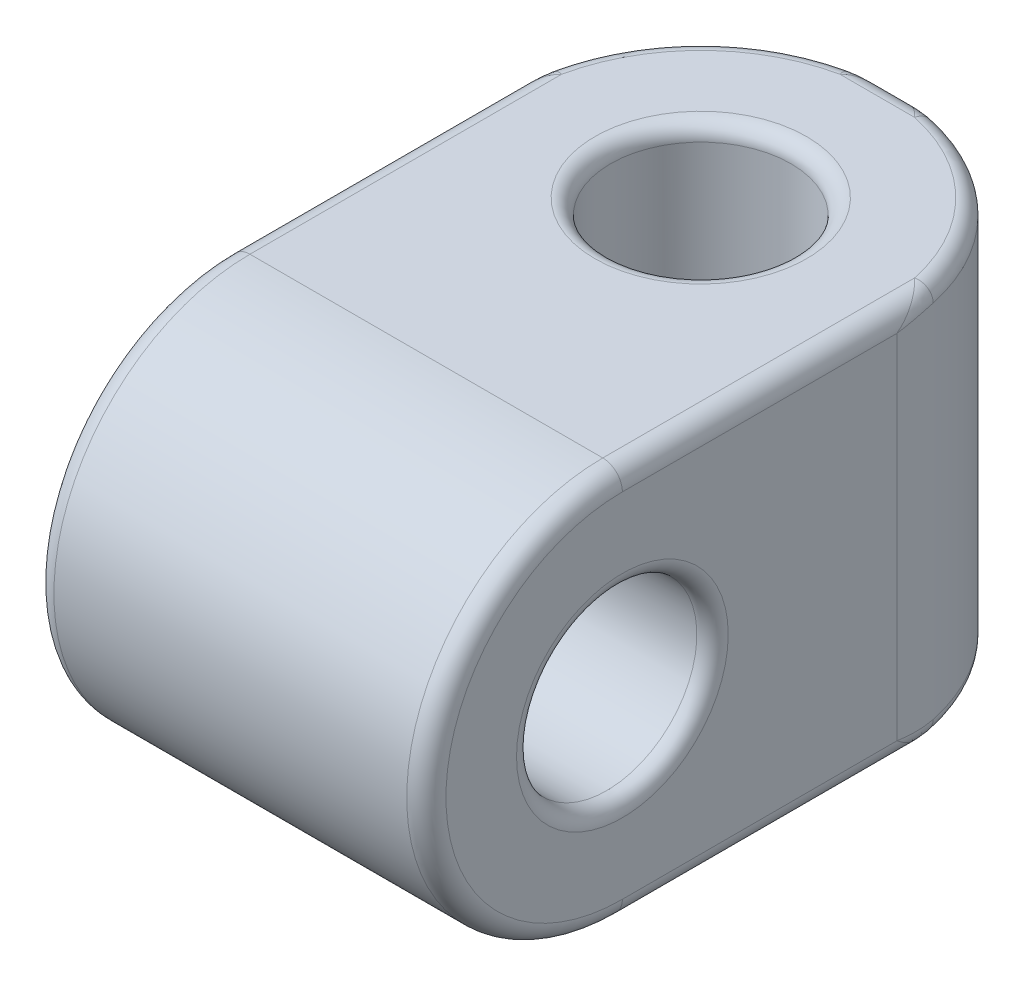
from build123d import *

# Parameters (mm, degrees)
SKETCH1_R           = 0.575
BOSS_EXTRUDE1_DEPTH = 2.5
FILLET1_R           = 0.125
CUT_EXTRUDE2_DEPTH  = 2.5
FILLET2_R           = 0.1


with BuildPart() as part:
    # Sketch1 → Boss-Extrude1 (new body)
    with BuildSketch(Plane(origin=(0, 0, 0), x_dir=(0, 0, -1), z_dir=(1, 0, 0))):
        with BuildLine():
            Line((-2, 0), (-3, 0))
            ThreePointArc((-3, 0), (-4.25, -1.25), (-3, -2.5))
            Line((-3, -2.5), (-2, -2.5))
            Line((-2, -2.5), (0, -2.5))
            Line((0, -2.5), (0, 0))
            Line((0, 0), (-2, 0))
        make_face()
        with Locations((-3, -1.25)):
            Circle(SKETCH1_R, mode=Mode.SUBTRACT)
    extrude(amount=BOSS_EXTRUDE1_DEPTH)

    # Fillet1
    fillet1_edges = [part.edges().sort_by_distance(p)[0] for p in [
        (1.25, 0, 0),
        (1.25, -2.5, 0),
        (2.5, -1.25, 4.25),
        (2.5, -2.5, 1.5),
        (2.5, 0, 1.5),
        (0, -2.5, 1.5),
        (0, -1.25, 4.25),
        (0, 0, 1.5),
    ]]
    fillet(fillet1_edges, radius=FILLET1_R)

    # Sketch3 → Cut-Extrude2 (cut)
    with BuildSketch(Plane(origin=(0, 0, 0), x_dir=(1, 0, 0), z_dir=(0, 1, 0))):
        with BuildLine():
            Line((2.5, 0), (1.25, 0))
            ThreePointArc((1.25, 0), (1.529508497, -0.031650707), (1.794862368, -0.125))
            Line((1.794862368, -0.125), (2.375, -0.125))
            Line((2.375, -0.125), (2.375, -0.705137632))
            ThreePointArc((2.375, -0.705137632), (2.468349293, -0.970491503), (2.5, -1.25))
            Line((2.5, -1.25), (2.5, 0))
        make_face()
        with BuildLine():
            Line((2.375, -0.125), (1.794862368, -0.125))
            ThreePointArc((1.794862368, -0.125), (2.133883476, -0.366116524), (2.375, -0.705137632))
            Line((2.375, -0.705137632), (2.375, -0.125))
        make_face()
        with BuildLine():
            Line((0, 0), (0, -1.25))
            ThreePointArc((0, -1.25), (0.031650707, -0.970491503), (0.125, -0.705137632))
            Line((0.125, -0.705137632), (0.125, -0.125))
            Line((0.125, -0.125), (0.705137632, -0.125))
            ThreePointArc((0.705137632, -0.125), (0.970491503, -0.031650707), (1.25, 0))
            Line((1.25, 0), (0, 0))
        make_face()
        with BuildLine():
            Line((0.125, -0.125), (0.125, -0.705137632))
            ThreePointArc((0.125, -0.705137632), (0.366116524, -0.366116524), (0.705137632, -0.125))
            Line((0.705137632, -0.125), (0.125, -0.125))
        make_face()
        with BuildLine():
            ThreePointArc((1.825, -1.25), (1.25, -0.675), (0.675, -1.25))
            Line((0.675, -1.25), (1.825, -1.25))
        make_face()
        with BuildLine():
            Line((1.825, -1.25), (0.675, -1.25))
            ThreePointArc((0.675, -1.25), (1.25, -1.825), (1.825, -1.25))
        make_face()
    extrude(amount=-CUT_EXTRUDE2_DEPTH, mode=Mode.SUBTRACT)

    # Fillet2
    fillet2_edges = [part.edges().sort_by_distance(p)[0] for p in [
        (2.133883476, 0, 0.366116524),
        (2.465037147, -0.038291833, 0.956427764),
        (1.54357577, -0.038290934, 0.034963671),
    ]]
    fillet(fillet2_edges, radius=FILLET2_R)
    fillet2_2_edges = [part.edges().sort_by_distance(p)[0] for p in [
        (0.366116524, 0, 0.366116524),
        (0.956424238, -0.038290936, 0.034963669),
        (0.034949928, -0.038305199, 0.956481108),
    ]]
    fillet(fillet2_2_edges, radius=FILLET2_R)
    fillet2_3_edges = [part.edges().sort_by_distance(p)[0] for p in [
        (0.675, 0, 1.25),
    ]]
    fillet(fillet2_3_edges, radius=FILLET2_R)
    fillet2_4_edges = [part.edges().sort_by_distance(p)[0] for p in [
        (1.543518889, -2.461694801, 0.034949927),
        (2.133883476, -2.5, 0.366116524),
        (2.465037147, -2.461708167, 0.956427764),
    ]]
    fillet(fillet2_4_edges, radius=FILLET2_R)
    fillet2_5_edges = [part.edges().sort_by_distance(p)[0] for p in [
        (0.675, -2.5, 1.25),
    ]]
    fillet(fillet2_5_edges, radius=FILLET2_R)
    fillet2_6_edges = [part.edges().sort_by_distance(p)[0] for p in [
        (2.5, -1.25, 3.575),
    ]]
    fillet(fillet2_6_edges, radius=FILLET2_R)
    fillet2_7_edges = [part.edges().sort_by_distance(p)[0] for p in [
        (0, -1.25, 3.575),
    ]]
    fillet(fillet2_7_edges, radius=FILLET2_R)
    fillet2_8_edges = [part.edges().sort_by_distance(p)[0] for p in [
        (0.034949928, -2.461694801, 0.956481108),
        (0.366116524, -2.5, 0.366116524),
        (0.956424205, -2.461709058, 0.034963696),
    ]]
    fillet(fillet2_8_edges, radius=FILLET2_R)


solid = part.part
